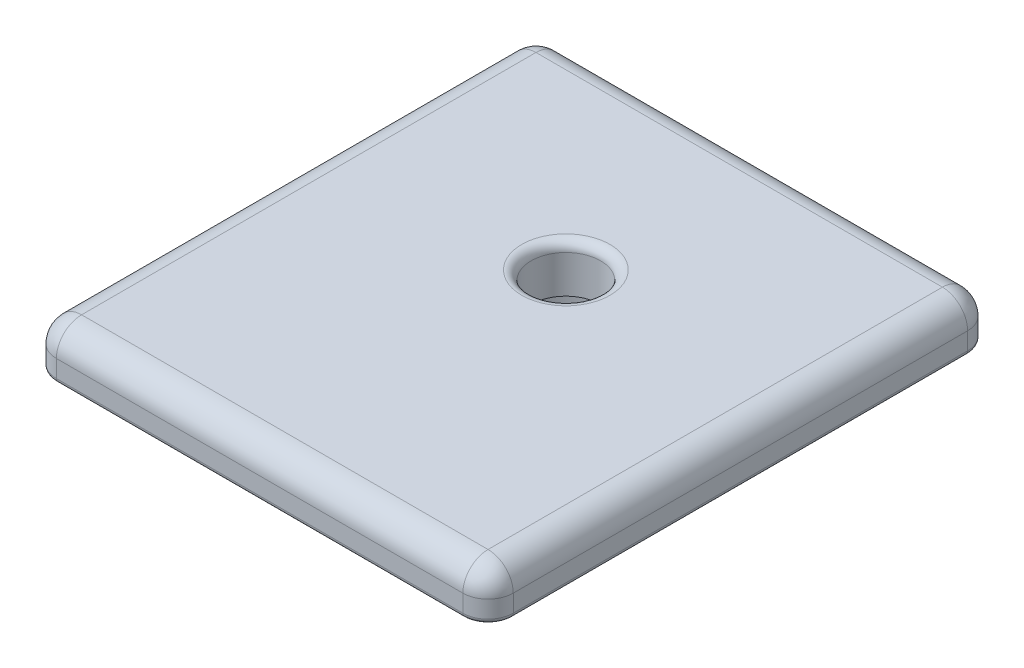
from build123d import *

# Parameters (mm, degrees)
SKETCH_1_W          = 9.5
SKETCH_1_H          = 6.52
EXTRUDE_1_DEPTH     = 2
SKETCH_2_W          = 14.5
SKETCH_2_H          = 16.02
EXTRUDE_2_DEPTH     = 1.5
SKETCH_3_R          = 1.1
CUT_EXTRUDE_1_DEPTH = 14.864587318
FILLET_3_R          = 0.8
FILLET_4_R          = 0.5
FILLET_7_R          = 0.15
FILLET_8_R          = 0.8
FILLET_10_R         = 0.3
SKETCH_4_R          = 2.1
CUT_EXTRUDE_2_DEPTH = 14.563804108
FILLET_11_R         = 0.3
FILLET_12_R         = 0.15


with BuildPart() as part:
    # Эскиз1 → Бобышка-Вытянуть1 (new body)
    with BuildSketch(Plane(origin=(0, 0, 0), x_dir=(1, 0, 0), z_dir=(0, 1, 0))):
        with Locations((1.785821709, 2.843815878)):
            Rectangle(SKETCH_1_W, SKETCH_1_H)
    extrude(amount=EXTRUDE_1_DEPTH)

    # Эскиз2 → Бобышка-Вытянуть2 (add)
    with BuildSketch(Plane(origin=(0, 2, 0), x_dir=(1, 0, 0), z_dir=(0, 1, 0))):
        with Locations((1.785821709, -1.906184122)):
            Rectangle(SKETCH_2_W, SKETCH_2_H)
    extrude(amount=EXTRUDE_2_DEPTH)

    # Эскиз3 → Вырез-Вытянуть1 (cut, through all)
    with BuildSketch(Plane(origin=(0, 3.5, 0), x_dir=(1, 0, 0), z_dir=(0, 1, 0))):
        with Locations(Location((1.785821709, -0.196184122, 0), (0, 0, 270))):
            Circle(SKETCH_3_R)
    extrude(amount=-CUT_EXTRUDE_1_DEPTH, mode=Mode.SUBTRACT)

    # Скругление3
    fillet_3_edges = [part.edges().sort_by_distance(p)[0] for p in [
        (-5.464178291, 3.5, 1.906184122),
        (1.785821709, 3.5, 9.916184122),
        (9.035821709, 3.5, 1.906184122),
        (1.785821709, 3.5, -6.103815878),
    ]]
    fillet(fillet_3_edges, radius=FILLET_3_R)

    # Скругление4
    fillet_4_edges = [part.edges().sort_by_distance(p)[0] for p in [
        (-2.964178291, 1, -6.103815878),
        (6.535821709, 1, -6.103815878),
        (6.535821709, 1, 0.416184122),
        (-2.964178291, 1, 0.416184122),
    ]]
    fillet(fillet_4_edges, radius=FILLET_4_R)

    # Скругление7
    fillet_7_edges = [part.edges().sort_by_distance(p)[0] for p in [
        (-5.464178291, 2, 1.906184122),
        (1.785821709, 2, 9.916184122),
        (9.035821709, 2, 1.906184122),
        (7.535821709, 2, -6.103815878),
        (-3.964178291, 2, -6.103815878),
    ]]
    fillet(fillet_7_edges, radius=FILLET_7_R)

    # Скругление8
    # the kernel refuses this fillet: 0.8 mm, written as the material it takes off along each edge
    with BuildSketch(Plane(origin=(-4.664178291, 2, -5.303815878), x_dir=(-1, 0, 0), z_dir=(0, 0, 1))) as fillet_8_piece_1:
        with BuildLine():
            CenterArc((0.65, -0.15), 0.15, 0, 90)
            Line((0.8, -0.15), (0.8, 0))
            Line((0.8, 0), (0.65, 0))
        make_face()
    revolve(axis=Axis((-4.664178291, 2, -5.303815878), (0, -1, 0)), revolution_arc=90, mode=Mode.SUBTRACT)
    with BuildSketch(Plane(origin=(-4.664178291, 2, 9.116184122), x_dir=(0, 0, 1), z_dir=(1, 0, 0))) as fillet_8_piece_2:
        with BuildLine():
            CenterArc((0.65, -0.15), 0.15, 0, 90)
            Line((0.8, -0.15), (0.8, 0))
            Line((0.8, 0), (0.65, 0))
        make_face()
    revolve(axis=Axis((-4.664178291, 2, 9.116184122), (0, -1, 0)), revolution_arc=90, mode=Mode.SUBTRACT)
    with BuildSketch(Plane(origin=(8.235821709, 2, 9.116184122), x_dir=(1, 0, 0), z_dir=(0, 0, -1))) as fillet_8_piece_3:
        with BuildLine():
            CenterArc((0.65, -0.15), 0.15, 0, 90)
            Line((0.8, -0.15), (0.8, 0))
            Line((0.8, 0), (0.65, 0))
        make_face()
    revolve(axis=Axis((8.235821709, 2, 9.116184122), (0, -1, 0)), revolution_arc=90, mode=Mode.SUBTRACT)
    with BuildSketch(Plane(origin=(8.235821709, 2, -5.303815878), x_dir=(0, 0, -1), z_dir=(-1, 0, 0))) as fillet_8_piece_4:
        with BuildLine():
            CenterArc((0.65, -0.15), 0.15, 0, 90)
            Line((0.8, -0.15), (0.8, 0))
            Line((0.8, 0), (0.65, 0))
        make_face()
    revolve(axis=Axis((8.235821709, 2, -5.303815878), (0, -1, 0)), revolution_arc=90, mode=Mode.SUBTRACT)
    with BuildSketch(Plane(origin=(8.235821709, 2.7, 9.116184122), x_dir=(1, 0, 0), z_dir=(0, 0, 1))) as fillet_8_piece_5_section:
        Polygon((0, 0), (FILLET_8_R, 0), (FILLET_8_R, FILLET_8_R), (0, FILLET_8_R), align=None)
    fillet_8_piece_5 = extrude(amount=FILLET_8_R, mode=Mode.PRIVATE)
    fillet_8_piece_5 = fillet_8_piece_5 - Plane(origin=(8.235821709, 2.7, 9.116184122), x_dir=(-0.7071067811865475, -0.7071067811865475, 0), z_dir=(0, 0, 1)) * Sphere(FILLET_8_R, mode=Mode.PRIVATE)
    add(fillet_8_piece_5, mode=Mode.SUBTRACT)
    with BuildSketch(Plane(origin=(-4.664178291, 2.7, 9.116184122), x_dir=(-1, 0, 0), z_dir=(0, 0, 1))) as fillet_8_piece_6_section:
        Polygon((0, 0), (FILLET_8_R, 0), (FILLET_8_R, -FILLET_8_R), (0, -FILLET_8_R), align=None)
    fillet_8_piece_6 = extrude(amount=FILLET_8_R, mode=Mode.PRIVATE)
    fillet_8_piece_6 = fillet_8_piece_6 - Plane(origin=(-4.664178291, 2.7, 9.116184122), x_dir=(0.7071067811865475, -0.7071067811865475, 0), z_dir=(0, 0, 1)) * Sphere(FILLET_8_R, mode=Mode.PRIVATE)
    add(fillet_8_piece_6, mode=Mode.SUBTRACT)
    with BuildSketch(Plane(origin=(8.235821709, 2.7, -5.303815878), x_dir=(1, 0, 0), z_dir=(0, 0, -1))) as fillet_8_piece_7_section:
        Polygon((0, 0), (FILLET_8_R, 0), (FILLET_8_R, -FILLET_8_R), (0, -FILLET_8_R), align=None)
    fillet_8_piece_7 = extrude(amount=FILLET_8_R, mode=Mode.PRIVATE)
    fillet_8_piece_7 = fillet_8_piece_7 - Plane(origin=(8.235821709, 2.7, -5.303815878), x_dir=(-0.7071067811865475, -0.7071067811865475, 0), z_dir=(0, 0, -1)) * Sphere(FILLET_8_R, mode=Mode.PRIVATE)
    add(fillet_8_piece_7, mode=Mode.SUBTRACT)
    with BuildSketch(Plane(origin=(-4.664178291, 2.7, -5.303815878), x_dir=(-1, 0, 0), z_dir=(0, 0, -1))) as fillet_8_piece_8_section:
        Polygon((0, 0), (FILLET_8_R, 0), (FILLET_8_R, FILLET_8_R), (0, FILLET_8_R), align=None)
    fillet_8_piece_8 = extrude(amount=FILLET_8_R, mode=Mode.PRIVATE)
    fillet_8_piece_8 = fillet_8_piece_8 - Plane(origin=(-4.664178291, 2.7, -5.303815878), x_dir=(0.7071067811865475, -0.7071067811865475, 0), z_dir=(0, 0, -1)) * Sphere(FILLET_8_R, mode=Mode.PRIVATE)
    add(fillet_8_piece_8, mode=Mode.SUBTRACT)
    with BuildSketch(Plane(origin=(-5.464178291, 2, -6.103815878), x_dir=(1, 0, 0), z_dir=(0, 1, 0)), Plane(origin=(9.035821709, 2, 9.916184122), x_dir=(-1, 0, 0), z_dir=(0, 1, 0))) as fillet_8_piece_9:
        with BuildLine():
            CenterArc((FILLET_8_R, -FILLET_8_R), FILLET_8_R, 90, 90)
            Line((0, -FILLET_8_R), (0, 0))
            Line((0, 0), (FILLET_8_R, 0))
        make_face()
    extrude(amount=0.7, mode=Mode.SUBTRACT)
    with BuildSketch(Plane(origin=(9.035821709, 2, -6.103815878), x_dir=(-1, 0, 0), z_dir=(0, 1, 0)), Plane(origin=(-5.464178291, 2, 9.916184122), x_dir=(1, 0, 0), z_dir=(0, 1, 0))) as fillet_8_piece_10:
        with BuildLine():
            CenterArc((FILLET_8_R, FILLET_8_R), FILLET_8_R, 180, 90)
            Line((0, FILLET_8_R), (0, 0))
            Line((0, 0), (FILLET_8_R, 0))
        make_face()
    extrude(amount=0.7, mode=Mode.SUBTRACT)

    # Скругление10
    fillet_10_edges = [part.edges().sort_by_distance(p)[0] for p in [
        (1.785821709, 3.5, -0.903815878),
    ]]
    fillet(fillet_10_edges, radius=FILLET_10_R)

    # Эскиз4 → Вырез-Вытянуть2 (cut, through all)
    with BuildSketch(Plane.XZ.offset(-2)):
        with Locations((1.785821709, 0.196184122)):
            Circle(SKETCH_4_R)
    extrude(amount=CUT_EXTRUDE_2_DEPTH, mode=Mode.SUBTRACT)

    # Скругление11
    fillet_11_edges = [part.edges().sort_by_distance(p)[0] for p in [
        (1.785821709, 0, -1.903815878),
        (-0.302622688, 1, 0.416184122),
        (3.874266106, 1, 0.416184122),
    ]]
    fillet(fillet_11_edges, radius=FILLET_11_R)

    # Скругление12
    fillet_12_edges = [part.edges().sort_by_distance(p)[0] for p in [
        (5.110154857, 0, 0.416184122),
        (-0.608464555, 0, 0.416152145),
        (4.180107973, 0, 0.416152145),
        (-0.383168508, 0.105102909, 0.309183864),
        (3.954811922, 0.10510291, 0.309183857),
        (-1.538511439, 0, 0.416184122),
        (-2.964178291, 0, -2.843815878),
        (1.785821709, 0, -6.103815878),
        (6.535821709, 0, -2.843815878),
        (-2.817731681, 0, -5.957369269),
        (6.3893751, 0, -5.957369269),
        (6.3893751, 0, 0.269737512),
        (-2.817731681, 0, 0.269737512),
    ]]
    fillet(fillet_12_edges, radius=FILLET_12_R)


solid = part.part
